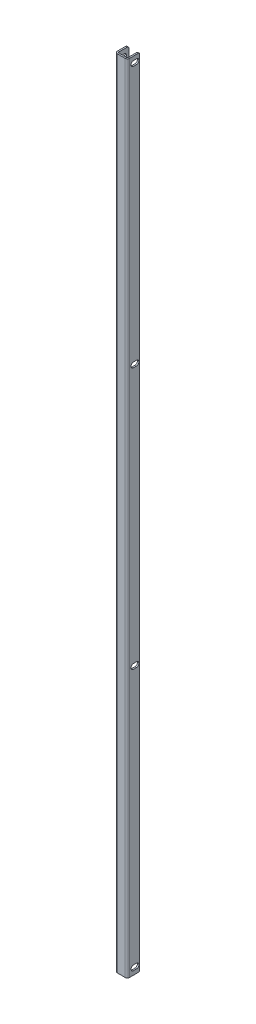
from build123d import *

# Parameters (mm, degrees)
BASE_FLANGE1_DEPTH = 1613
CUT_EXTRUDE1_REACH = 1615.344
SKETCH6_R          = 4.5
FILLET1_R          = 3
CUT_EXTRUDE2_REACH = 1615.344
LPATTERN1_COUNT    = 4
LPATTERN1_PITCH    = 529


# Sheet-metal steps are written as plain solids
with BuildPart() as part:
    # Sketch1 → Base-Flange1 (new body)
    with BuildSketch(Plane(origin=(0, 0, 0), x_dir=(1, 0, 0), z_dir=(0, 1, 0))):
        with BuildLine():
            Line((-12.5, 25), (-12.5, 4.5))
            ThreePointArc((-12.5, 4.5), (-11.181980515, 1.318019485), (-8, 0))
            Line((-8, 0), (8, 0))
            ThreePointArc((8, 0), (11.181980515, 1.318019485), (12.5, 4.5))
            Line((12.5, 4.5), (12.5, 25))
            Line((12.5, 25), (9.5, 25))
            Line((9.5, 25), (9.5, 4.5))
            ThreePointArc((9.5, 4.5), (9.060660172, 3.439339828), (8, 3))
            Line((8, 3), (-8, 3))
            ThreePointArc((-8, 3), (-9.060660172, 3.439339828), (-9.5, 4.5))
            Line((-9.5, 4.5), (-9.5, 25))
            Line((-9.5, 25), (-12.5, 25))
        make_face()
    extrude(amount=BASE_FLANGE1_DEPTH)

    # Sketch6 → Cut-Extrude1 (cut, up to next)
    with BuildSketch(Plane(origin=(-9.5, 0, 0), x_dir=(0, 0, -1), z_dir=(1, 0, 0)), mode=Mode.PRIVATE) as cut_extrude1_sk1:
        with Locations((15.5, 13)):
            Circle(SKETCH6_R)
    cut_extrude1_tool1 = extrude(cut_extrude1_sk1.sketch, amount=-CUT_EXTRUDE1_REACH, mode=Mode.PRIVATE) & part.part
    cut_extrude1 = cut_extrude1_tool1.solids().sort_by_distance((-9.5, 13, -15.5))[0]
    add(cut_extrude1, mode=Mode.SUBTRACT)

    # Fillet1
    fillet1_edges = [part.edges().sort_by_distance(p)[0] for p in [
        (11, 0, -25),
        (-11, 0, -25),
        (11, 1613, -25),
        (-11, 1613, -25),
    ]]
    fillet(fillet1_edges, radius=FILLET1_R)

    # Sketch7 → Cut-Extrude2 (cut, up to next)
    with BuildSketch(Plane.ZY.offset(-9.5), mode=Mode.PRIVATE) as cut_extrude2_sk1:
        with BuildLine():
            Line((-18.5, 18), (-12.5, 18))
            ThreePointArc((-12.5, 18), (-7.5, 13), (-12.5, 8))
            Line((-12.5, 8), (-18.5, 8))
            ThreePointArc((-18.5, 8), (-23.5, 13), (-18.5, 18))
        make_face()
    cut_extrude2_tool1 = extrude(cut_extrude2_sk1.sketch, amount=-CUT_EXTRUDE2_REACH, mode=Mode.PRIVATE) & part.part
    cut_extrude2 = cut_extrude2_tool1.solids().sort_by_distance((9.5, 13, -15.5))[0]
    add(cut_extrude2, mode=Mode.SUBTRACT)

    # LPattern1: Cut-Extrude1, Cut-Extrude2 ×4
    with Locations(*[(0, i * LPATTERN1_PITCH, 0) for i in range(1, LPATTERN1_COUNT)]):
        add(cut_extrude1, mode=Mode.SUBTRACT)
        add(cut_extrude2, mode=Mode.SUBTRACT)


solid = part.part
